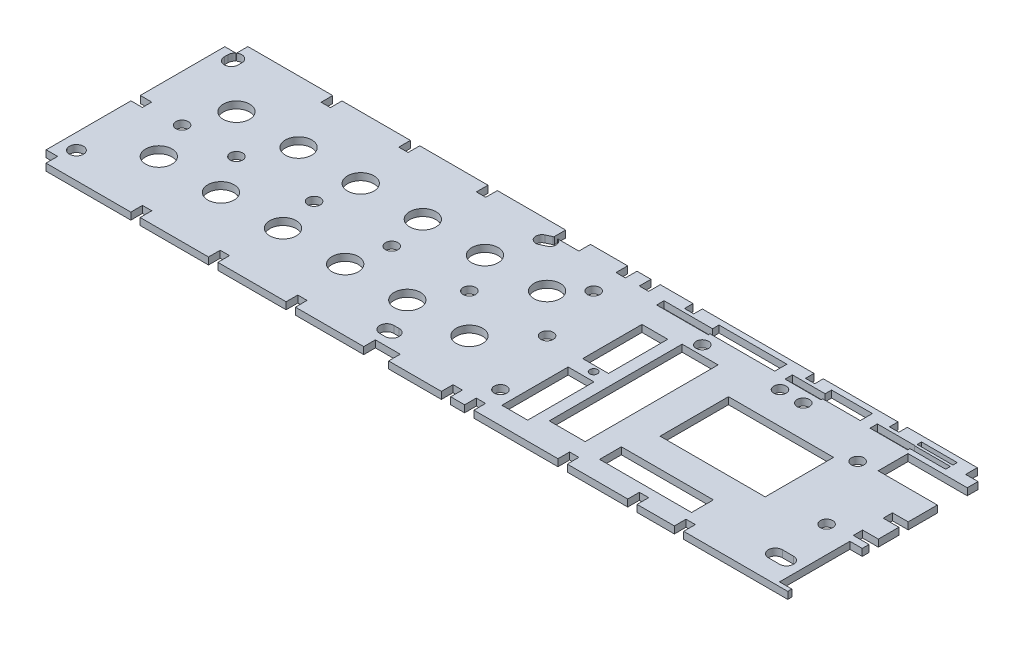
from build123d import *

# Parameters (mm, degrees)
SKETCH1_R           = 4.5
SKETCH1_R_2         = 8.5
SKETCH1_R_3         = 4
SKETCH1_W           = 59.227902108
SKETCH1_H           = 14.048666808
SKETCH1_W_2         = 16.602969863
SKETCH1_H_2         = 42.683012068
SKETCH1_R_4         = 2.466961033
SKETCH1_W_3         = 23.148371443
SKETCH1_H_3         = 85.569152371
SKETCH1_H_4         = 38.143470965
SKETCH1_W_4         = 67.68903098
SKETCH1_H_5         = 44.061727713
SKETCH1_W_5         = 22.994184748
SKETCH1_H_6         = 2.807717578
BOSS_EXTRUDE1_DEPTH = 4.5


with BuildPart() as part:
    # Sketch1 → Boss-Extrude1 (new body)
    with BuildSketch(Plane(origin=(0, 0, 0), x_dir=(1, 0, 0), z_dir=(0, 1, 0))):
        with BuildLine():
            Line((62.002732312, 130), (7.385469745, 130))
            Line((7.385469745, 130), (7.385469745, 122.667172808))
            ThreePointArc((7.385469745, 122.667172808), (12.059686123, 123.005589918), (14.5, 119.0046284))
            Line((14.5, 119.0046284), (14.5, 116.692166772))
            ThreePointArc((14.5, 116.692166772), (10, 112.192166772), (5.5, 116.692166772))
            Line((5.5, 116.692166772), (5.5, 119.0046284))
            ThreePointArc((5.5, 119.0046284), (5.937756033, 120.940648531), (7.165855089, 122.5))
            Line((7.165855089, 122.5), (0, 122.5))
            Line((0, 122.5), (0, 68.086598687))
            Line((0, 68.086598687), (7.385469745, 68.086598687))
            Line((7.385469745, 68.086598687), (7.385469745, 62.086598687))
            Line((7.385469745, 62.086598687), (0, 62.086598687))
            Line((0, 62.086598687), (0, 7.5))
            Line((0, 7.5), (7.385469745, 7.5))
            Line((7.385469745, 7.5), (7.385469745, 0))
            Line((7.385469745, 0), (62.002732312, 0))
            Line((62.002732312, 0), (62.002732312, 7.5))
            Line((62.002732312, 7.5), (68.002732312, 7.5))
            Line((68.002732312, 7.5), (68.002732312, 0))
            Line((68.002732312, 0), (112.032509858, 0))
            Line((112.032509858, 0), (112.032509858, 7.5))
            Line((112.032509858, 7.5), (118.032509858, 7.5))
            Line((118.032509858, 7.5), (118.032509858, 0))
            Line((118.032509858, 0), (161.992021545, 0))
            Line((161.992021545, 0), (161.992021545, 7.5))
            Line((161.992021545, 7.5), (167.992021545, 7.5))
            Line((167.992021545, 7.5), (167.992021545, 0))
            Line((167.992021545, 0), (211.980665765, 0))
            Line((211.980665765, 0), (211.980665765, 7.5))
            Line((211.980665765, 7.5), (227.980665765, 7.5))
            Line((227.980665765, 7.5), (227.980665765, 0))
            Line((227.980665765, 0), (261.969584498, 0))
            Line((261.969584498, 0), (261.969584498, 7.5))
            Line((261.969584498, 7.5), (267.969584498, 7.5))
            Line((267.969584498, 7.5), (267.969584498, 0))
            Line((267.969584498, 0), (276.920755035, 0))
            Line((276.920755035, 0), (276.920755035, 7.5))
            Line((276.920755035, 7.5), (282.920755035, 7.5))
            Line((282.920755035, 7.5), (282.920755035, 0))
            Line((282.920755035, 0), (337.020889406, 0))
            Line((337.020889406, 0), (337.020889406, 7.5))
            Line((337.020889406, 7.5), (343.020889406, 7.5))
            Line((343.020889406, 7.5), (343.020889406, 0))
            Line((343.020889406, 0), (381.96318409, 0))
            Line((381.96318409, 0), (381.96318409, 7.5))
            Line((381.96318409, 7.5), (387.96318409, 7.5))
            Line((387.96318409, 7.5), (387.96318409, 0))
            Line((387.96318409, 0), (411.996997426, 0))
            Line((411.996997426, 0), (411.996997426, 7.5))
            Line((411.996997426, 7.5), (417.996997426, 7.5))
            Line((417.996997426, 7.5), (417.996997426, 0))
            Line((417.996997426, 0), (485, 0))
            Line((485, 0), (485, 2.644509449))
            Line((485, 2.644509449), (477.041499419, 2.644509449))
            Line((477.041499419, 2.644509449), (477.041499419, 47.941310654))
            Line((477.041499419, 47.941310654), (485, 47.941310654))
            Line((485, 47.941310654), (485, 52.306927402))
            Line((485, 52.306927402), (474.892633063, 52.306927402))
            Line((474.892633063, 52.306927402), (474.892633063, 58.306927402))
            Line((474.892633063, 58.306927402), (485, 58.306927402))
            Line((485, 58.306927402), (485, 71.532960334))
            Line((485, 71.532960334), (474.892633063, 71.532960334))
            Line((474.892633063, 71.532960334), (474.892633063, 77.532960334))
            Line((474.892633063, 77.532960334), (485, 77.532960334))
            Line((485, 77.532960334), (485, 96.337752746))
            Line((485, 96.337752746), (446.852106169, 96.337752746))
            Line((446.852106169, 96.337752746), (446.852106169, 115.573963572))
            Line((446.852106169, 115.573963572), (485, 115.573963572))
            Line((485, 115.573963572), (485, 122.491965735))
            Line((485, 122.491965735), (477.041499419, 122.491965735))
            Line((477.041499419, 122.491965735), (477.041499419, 130))
            Line((477.041499419, 130), (431.99827146, 130))
            Line((431.99827146, 130), (431.99827146, 124.5))
            Line((431.99827146, 124.5), (425.99827146, 124.5))
            Line((425.99827146, 124.5), (425.99827146, 130))
            Line((425.99827146, 130), (377.887919693, 130))
            Line((377.887919693, 130), (377.887919693, 124.5))
            Line((377.887919693, 124.5), (371.887919693, 124.5))
            Line((371.887919693, 124.5), (371.887919693, 130))
            Line((371.887919693, 130), (300.000783582, 130))
            Line((300.000783582, 130), (300.000783582, 124.5))
            Line((300.000783582, 124.5), (294.000783582, 124.5))
            Line((294.000783582, 124.5), (294.000783582, 130))
            Line((294.000783582, 130), (272.916462339, 130))
            Line((272.916462339, 130), (272.916462339, 122.5))
            Line((272.916462339, 122.5), (266.916462339, 122.5))
            Line((266.916462339, 122.5), (266.916462339, 130))
            Line((266.916462339, 130), (257.911220927, 130))
            Line((257.911220927, 130), (257.911220927, 122.5))
            Line((257.911220927, 122.5), (251.911220927, 122.5))
            Line((251.911220927, 122.5), (251.911220927, 130))
            Line((251.911220927, 130), (227.980665765, 130))
            Line((227.980665765, 130), (227.980665765, 122.5))
            Line((227.980665765, 122.5), (214.26783099, 122.5))
            ThreePointArc((214.26783099, 122.5), (217.24569094, 119.006140829), (214.978456965, 115.014355278))
            Line((214.978456965, 115.014355278), (211.488265169, 113.358129119))
            ThreePointArc((211.488265169, 113.358129119), (206.15964453, 115.257024084), (208.058539495, 120.585644722))
            Line((208.058539495, 120.585644722), (211.548731291, 122.241870881))
            ThreePointArc((211.548731291, 122.241870881), (211.897931851, 122.38776287), (212.259357266, 122.5))
            Line((212.259357266, 122.5), (211.980665765, 122.5))
            Line((211.980665765, 122.5), (211.980665765, 130))
            Line((211.980665765, 130), (167.992021545, 130))
            Line((167.992021545, 130), (167.992021545, 122.5))
            Line((167.992021545, 122.5), (161.992021545, 122.5))
            Line((161.992021545, 122.5), (161.992021545, 130))
            Line((161.992021545, 130), (118.032509858, 130))
            Line((118.032509858, 130), (118.032509858, 122.5))
            Line((118.032509858, 122.5), (112.032509858, 122.5))
            Line((112.032509858, 122.5), (112.032509858, 130))
            Line((112.032509858, 130), (68.002732312, 130))
            Line((68.002732312, 130), (68.002732312, 122.5))
            Line((68.002732312, 122.5), (62.002732312, 122.5))
            Line((62.002732312, 122.5), (62.002732312, 130))
        make_face()
        with Locations((10, 17)):
            Circle(SKETCH1_R, mode=Mode.SUBTRACT)
        with BuildLine():
            ThreePointArc((209.806870097, 12.5), (205.306870097, 17), (209.806870097, 21.5))
            Line((209.806870097, 21.5), (213.263594128, 21.5))
            ThreePointArc((213.263594128, 21.5), (217.763594128, 17), (213.263594128, 12.5))
            Line((213.263594128, 12.5), (209.806870097, 12.5))
        make_face(mode=Mode.SUBTRACT)
        with Locations((40.013782172, 40.004966614)):
            Circle(SKETCH1_R_2, mode=Mode.SUBTRACT)
        with Locations((80.013782172, 40.004966614)):
            Circle(SKETCH1_R_2, mode=Mode.SUBTRACT)
        with Locations((120.013782172, 40.004966614)):
            Circle(SKETCH1_R_2, mode=Mode.SUBTRACT)
        with Locations((160.013782172, 40.004966614)):
            Circle(SKETCH1_R_2, mode=Mode.SUBTRACT)
        with Locations((200.013782172, 40.004966614)):
            Circle(SKETCH1_R_2, mode=Mode.SUBTRACT)
        with Locations((240.013782172, 40.004966614)):
            Circle(SKETCH1_R_2, mode=Mode.SUBTRACT)
        with Locations((280, 20)):
            Circle(SKETCH1_R_3, mode=Mode.SUBTRACT)
        with Locations((380.411034456, 20.047190056)):
            Rectangle(SKETCH1_W, SKETCH1_H, mode=Mode.SUBTRACT)
        with BuildLine():
            ThreePointArc((460, 12.5), (455.5, 17), (460, 21.5))
            Line((460, 21.5), (467.25387069, 21.5))
            ThreePointArc((467.25387069, 21.5), (471.75387069, 17), (467.25387069, 12.5))
            Line((467.25387069, 12.5), (460, 12.5))
        make_face(mode=Mode.SUBTRACT)
        with Locations((297.476007111, 33.087211158)):
            Rectangle(SKETCH1_W_2, SKETCH1_H_2, mode=Mode.SUBTRACT)
        with Locations((300, 60)):
            Circle(SKETCH1_R_4, mode=Mode.SUBTRACT)
        with Locations((324.695299051, 61.075682891)):
            Rectangle(SKETCH1_W_3, SKETCH1_H_3, mode=Mode.SUBTRACT)
        with Locations((460, 50)):
            Circle(SKETCH1_R_3, mode=Mode.SUBTRACT)
        with Locations((30, 65)):
            Circle(SKETCH1_R_3, mode=Mode.SUBTRACT)
        with Locations((65, 65)):
            Circle(SKETCH1_R_3, mode=Mode.SUBTRACT)
        with Locations((115, 65)):
            Circle(SKETCH1_R_3, mode=Mode.SUBTRACT)
        with Locations((40.013782172, 90.004966614)):
            Circle(SKETCH1_R_2, mode=Mode.SUBTRACT)
        with Locations((80.013782172, 90.004966614)):
            Circle(SKETCH1_R_2, mode=Mode.SUBTRACT)
        with Locations((120.013782172, 90.004966614)):
            Circle(SKETCH1_R_2, mode=Mode.SUBTRACT)
        with Locations((165, 65)):
            Circle(SKETCH1_R_3, mode=Mode.SUBTRACT)
        with Locations((215, 65)):
            Circle(SKETCH1_R_3, mode=Mode.SUBTRACT)
        with Locations((160.013782172, 90.004966614)):
            Circle(SKETCH1_R_2, mode=Mode.SUBTRACT)
        with Locations((200.013782172, 90.004966614)):
            Circle(SKETCH1_R_2, mode=Mode.SUBTRACT)
        with Locations((240.013782172, 90.004966614)):
            Circle(SKETCH1_R_2, mode=Mode.SUBTRACT)
        with Locations((265, 65)):
            Circle(SKETCH1_R_3, mode=Mode.SUBTRACT)
        with Locations((297.476007111, 82.872796302)):
            Rectangle(SKETCH1_W_2, SKETCH1_H_4, mode=Mode.SUBTRACT)
        with Locations((391.187000473, 67.46144053)):
            Rectangle(SKETCH1_W_4, SKETCH1_H_5, mode=Mode.SUBTRACT)
        with Locations((435, 95)):
            Circle(SKETCH1_R_3, mode=Mode.SUBTRACT)
        with Locations((255, 105)):
            Circle(SKETCH1_R_3, mode=Mode.SUBTRACT)
        with Locations((320, 110)):
            Circle(SKETCH1_R_3, mode=Mode.SUBTRACT)
        Polygon((283.085809201, 117.5), (283.085809201, 122.235411884), (314.334759405, 122.235411884), (314.334759405, 126.4), (358.024535321, 126.4), (358.024535321, 118.592701195), (316.334759402, 118.592701195), (316.334759402, 117.5), align=None, mode=Mode.SUBTRACT)
        with Locations((370, 110)):
            Circle(SKETCH1_R_3, mode=Mode.SUBTRACT)
        with Locations((385, 110)):
            Circle(SKETCH1_R_3, mode=Mode.SUBTRACT)
        Polygon((365.730091621, 117.5), (365.730091621, 122.235411884), (386.832323877, 122.235411884), (386.832323877, 126.4), (413.096214621, 126.4), (413.096214621, 118.592701195), (388.832323875, 118.592701195), (388.832323875, 117.5), align=None, mode=Mode.SUBTRACT)
        Polygon((467.691755373, 118.935538121), (444.73163474, 118.935538121), (444.73163474, 117.5), (420.447958103, 117.5), (420.447958103, 122.235411884), (444.73163474, 122.235411884), (444.73163474, 122.021945082), (467.691755373, 122.021945082), align=None, mode=Mode.SUBTRACT)
        with Locations((456.228727114, 124.996141211)):
            Rectangle(SKETCH1_W_5, SKETCH1_H_6, mode=Mode.SUBTRACT)
    extrude(amount=-BOSS_EXTRUDE1_DEPTH)


solid = part.part
